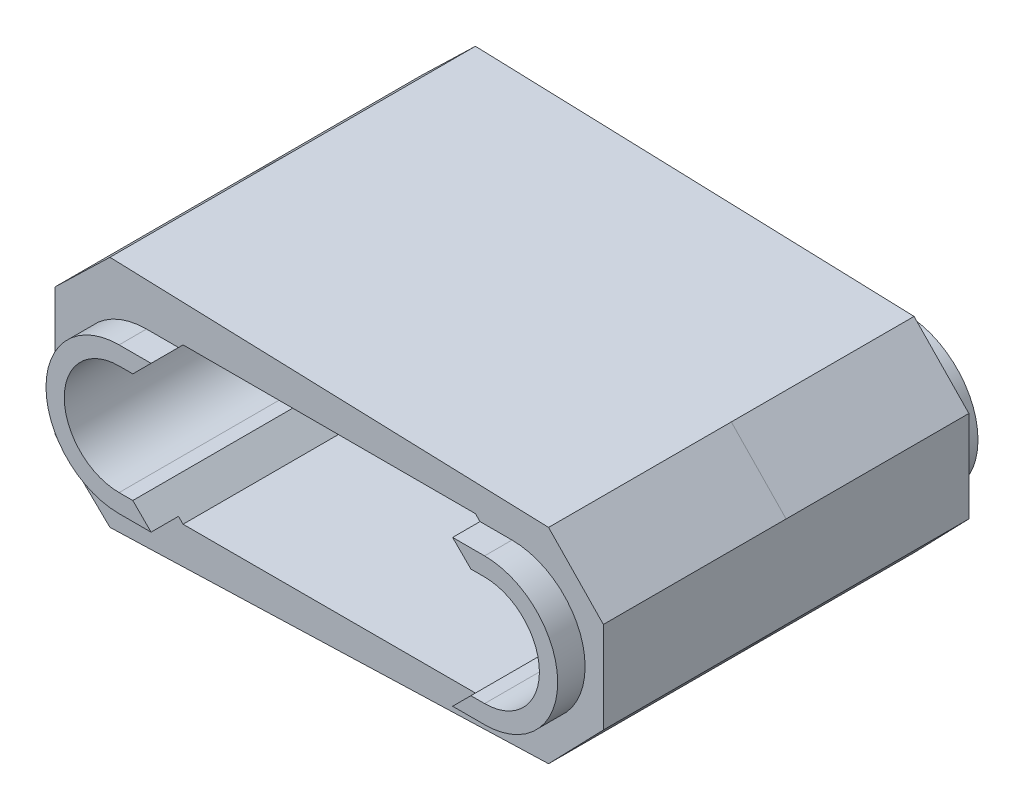
from build123d import *

# Parameters (mm, degrees)
BOSS_EXTRUDE1_DEPTH      = 10
CHAMFER1_SIZE            = 3
BOSS_EXTRUDE2_START      = -1.5
BOSS_EXTRUDE2_DEPTH      = 1.5
CHAMFER1_OF_MIRROR1_SIZE = 3
SKETCH2_W                = 16
SKETCH2_H                = 8.5
CUT_EXTRUDE1_DEPTH       = 39.340066647
CHAMFER2_SIZE            = 1.25


with BuildPart() as part:
    # Sketch1 → Boss-Extrude1 (new body)
    # profile 1 of 2: a face of its own
    with BuildSketch(Plane.XY):
        Polygon((30, 5.5), (30, -5.5), (0, -6.5), (0, 6.5), align=None)
        with BuildLine():
            ThreePointArc((5, 4), (1, 0), (5, -4))
            Line((5, -4), (25, -4))
            ThreePointArc((25, -4), (29, 0), (25, 4))
            Line((25, 4), (5, 4))
        make_face(mode=Mode.SUBTRACT)
    # profile 2 of 2: a face of its own
    with BuildSketch(Plane.XY):
        with BuildLine():
            Line((5, 4), (25, 4))
            ThreePointArc((25, 4), (29, 0), (25, -4))
            Line((25, -4), (5, -4))
            ThreePointArc((5, -4), (1, 0), (5, 4))
        make_face()
        with BuildLine():
            ThreePointArc((25, -3), (28, 0), (25, 3))
            Line((25, 3), (5, 3))
            ThreePointArc((5, 3), (2, 0), (5, -3))
            Line((5, -3), (25, -3))
        make_face(mode=Mode.SUBTRACT)
    boss_extrude1 = extrude(amount=BOSS_EXTRUDE1_DEPTH)

    # Chamfer1
    chamfer1_edges = [part.edges().sort_by_distance(p)[0] for p in [
        (30, -5.5, 5),
        (0, -6.5, 5),
        (0, 6.5, 5),
        (30, 5.5, 5),
    ]]
    chamfer(chamfer1_edges, length=CHAMFER1_SIZE)

    # Sketch1<4> → Boss-Extrude2 (add)
    with BuildSketch(Plane.XY.offset(BOSS_EXTRUDE2_START)):
        with BuildLine():
            Line((5, 4), (25, 4))
            ThreePointArc((25, 4), (29, 0), (25, -4))
            Line((25, -4), (5, -4))
            ThreePointArc((5, -4), (1, 0), (5, 4))
        make_face()
        with BuildLine():
            ThreePointArc((25, -3), (28, 0), (25, 3))
            Line((25, 3), (5, 3))
            ThreePointArc((5, 3), (2, 0), (5, -3))
            Line((5, -3), (25, -3))
        make_face(mode=Mode.SUBTRACT)
    boss_extrude2 = extrude(amount=BOSS_EXTRUDE2_DEPTH)


with BuildPart() as mirror1_1:
    # Mirror1: Boss-Extrude1, Boss-Extrude2 across plane
    add(boss_extrude1.mirror(Plane.XY.offset(10)))
    add(boss_extrude2.mirror(Plane.XY.offset(10)))

    # Chamfer1 of Mirror1
    chamfer1_of_mirror1_edges = [mirror1_1.edges().sort_by_distance(p)[0] for p in [
        (30, -5.5, 15),
        (0, -6.5, 15),
        (0, 6.5, 15),
        (30, 5.5, 15),
    ]]
    chamfer(chamfer1_of_mirror1_edges, length=CHAMFER1_OF_MIRROR1_SIZE)


with BuildPart() as part_1:
    add(part.part)

    # Mirror1 united with what the copies touc: union Mirror1_1
    add(mirror1_1.part)

    # Sketch2 → Cut-Extrude1 (cut, through all)
    with BuildSketch(Plane.XY.offset(21.5)):
        with Locations((15, 0)):
            Rectangle(SKETCH2_W, SKETCH2_H)
    extrude(amount=-CUT_EXTRUDE1_DEPTH, mode=Mode.SUBTRACT)

    # Chamfer2
    chamfer2_edges = [part_1.edges().sort_by_distance(p)[0] for p in [
        (23, -3, 10),
        (23, 3, 10),
        (7, -3, 10),
        (7, 3, 10),
    ]]
    chamfer(chamfer2_edges, length=CHAMFER2_SIZE - 0.0001)  # a hair under: the kernel refuses the full size


solid = part_1.part
